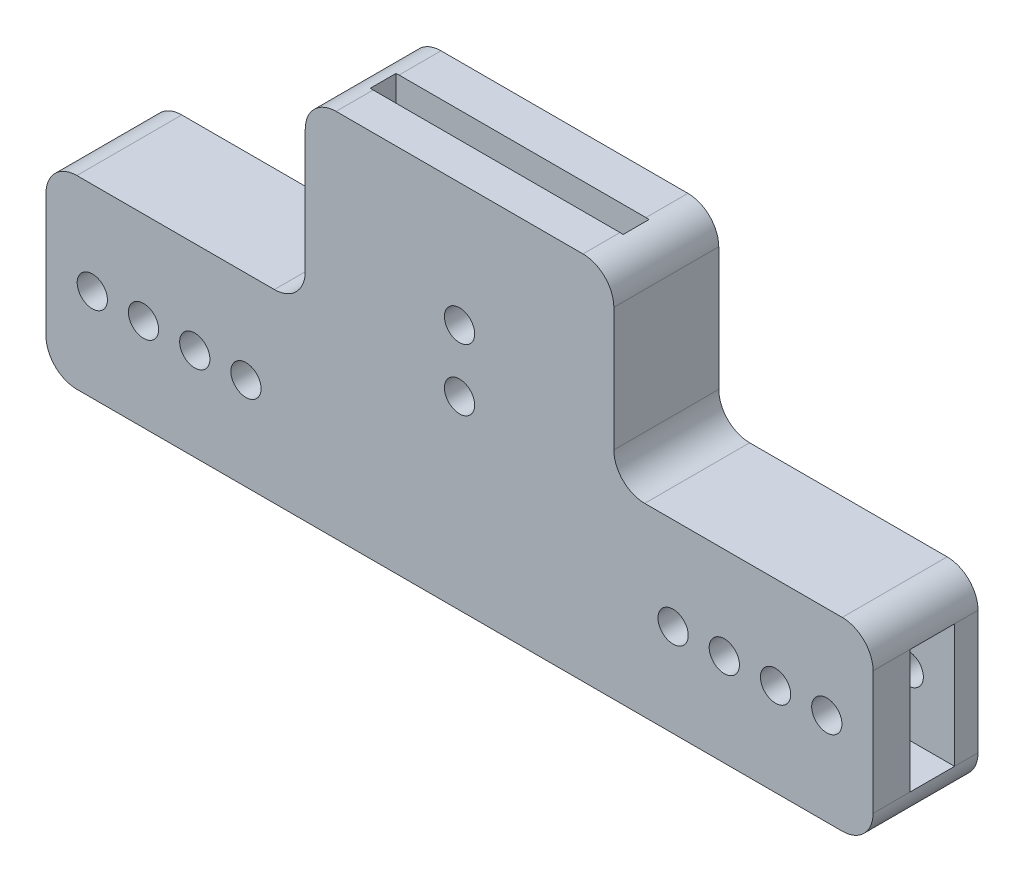
from build123d import *
from build123d.topology import SkipClean

# Parameters (mm, degrees)
SKETCH1_W           = 50
SKETCH1_H           = 60
BOSS_EXTRUDE1_DEPTH = 12
SKETCH2_W           = 41
SKETCH2_H           = 4.2
CUT_EXTRUDE1_DEPTH  = 67.098411479
SKETCH3_W           = 12
SKETCH3_H           = 30
BOSS_EXTRUDE2_DEPTH = 42
SKETCH4_W           = 7.2
SKETCH4_H           = 20
CUT_EXTRUDE2_DEPTH  = 42.5
SKETCH5_R           = 2.45
CUT_EXTRUDE3_DEPTH  = 17.5
FILLET1_R           = 5
SKETCH6_R           = 2.45
CUT_EXTRUDE4_DEPTH  = 35
BOSS_EXTRUDE3_START = 5
SKETCH7_R           = 2.45
BOSS_EXTRUDE3_DEPTH = 5


with BuildPart() as part:
    # Sketch1 → Boss-Extrude1 (new body)
    with BuildSketch(Plane.XY):
        Rectangle(SKETCH1_W, SKETCH1_H)
    extrude(amount=BOSS_EXTRUDE1_DEPTH)

    # Sketch2 → Cut-Extrude1 (cut, through all)
    with BuildSketch(Plane(origin=(0, 30, 0), x_dir=(1, 0, 0), z_dir=(0, 1, 0))):
        with Locations((0, -8.9)):
            Rectangle(SKETCH2_W, SKETCH2_H)
    extrude(amount=-CUT_EXTRUDE1_DEPTH, mode=Mode.SUBTRACT)

    # Sketch3 → Boss-Extrude2 (add)
    with BuildSketch(Plane.ZY.offset(25)):
        with Locations((6, -15)):
            Rectangle(SKETCH3_W, SKETCH3_H)
    boss_extrude2 = extrude(amount=BOSS_EXTRUDE2_DEPTH)

    # Sketch4 → Cut-Extrude2 (cut)
    with BuildSketch(Plane.ZY.offset(67)):
        with Locations((7.4, -15)):
            Rectangle(SKETCH4_W, SKETCH4_H)
    cut_extrude2 = extrude(amount=-CUT_EXTRUDE2_DEPTH, mode=Mode.SUBTRACT)

    # Sketch5 → Cut-Extrude3 (cut, symmetric)
    with BuildSketch(Plane.XY.offset(12)):
        with Locations((-59.5, -14.995756269)):
            Circle(SKETCH5_R)
        with Locations((-51.2, -14.995756269)):
            Circle(SKETCH5_R)
        with Locations((-42.9, -14.995756269)):
            Circle(SKETCH5_R)
        with Locations((-34.6, -14.995756269)):
            Circle(SKETCH5_R)
    cut_extrude3 = extrude(amount=CUT_EXTRUDE3_DEPTH, both=True, mode=Mode.SUBTRACT)

    # Mirror1: Boss-Extrude2, Cut-Extrude2, Cut-Extrude3 across plane
    add(boss_extrude2.mirror(Plane(origin=(0, 0, 0), x_dir=(0, 0, 1), z_dir=(1, 0, 0))))
    add(cut_extrude2.mirror(Plane(origin=(0, 0, 0), x_dir=(0, 0, 1), z_dir=(1, 0, 0))), mode=Mode.SUBTRACT)
    add(cut_extrude3.mirror(Plane(origin=(0, 0, 0), x_dir=(0, 0, 1), z_dir=(1, 0, 0))), mode=Mode.SUBTRACT)

    # Fillet1
    # the kernel refuses this fillet: 5 mm, written as the material it adds along each edge
    with BuildSketch(Plane(origin=(25, 0, 12), x_dir=(0, 1, 0), z_dir=(0, 0, -1))) as fillet1_piece_1:
        with BuildLine():
            CenterArc((FILLET1_R, FILLET1_R), FILLET1_R, 180, 90)
            Line((0, FILLET1_R), (0, 0))
            Line((0, 0), (FILLET1_R, 0))
        make_face()
    extrude(amount=12)
    with BuildSketch(Plane(origin=(-25, 0, 12), x_dir=(0, 1, 0), z_dir=(0, 0, -1))) as fillet1_piece_2:
        with BuildLine():
            CenterArc((FILLET1_R, -FILLET1_R), FILLET1_R, 90, 90)
            Line((0, -FILLET1_R), (0, 0))
            Line((0, 0), (FILLET1_R, 0))
        make_face()
    extrude(amount=12)
    # the kernel refuses this fillet: 5 mm, written as the material it takes off along each edge
    with BuildSketch(Plane(origin=(67, 0, 24.5), x_dir=(-1, 0, 0), z_dir=(0, 0, -1)), Plane(origin=(-67, -30, -12.5), x_dir=(0, 1, 0), z_dir=(0, 0, 1)), Plane(origin=(-25, 30, -12.5), x_dir=(1, 0, 0), z_dir=(0, 0, 1))) as fillet1_2_piece_1:
        with BuildLine():
            CenterArc((FILLET1_R, -FILLET1_R), FILLET1_R, 90, 90)
            Line((0, -FILLET1_R), (0, 0))
            Line((0, 0), (FILLET1_R, 0))
        make_face()
    extrude(amount=37, mode=Mode.SUBTRACT)
    with BuildSketch(Plane(origin=(67, -30, -12.5), x_dir=(0, 1, 0), z_dir=(0, 0, 1)), Plane(origin=(-67, 0, 24.5), x_dir=(1, 0, 0), z_dir=(0, 0, -1)), Plane(origin=(25, 30, -12.5), x_dir=(-1, 0, 0), z_dir=(0, 0, 1))) as fillet1_2_piece_2:
        with BuildLine():
            CenterArc((FILLET1_R, FILLET1_R), FILLET1_R, 180, 90)
            Line((0, FILLET1_R), (0, 0))
            Line((0, 0), (FILLET1_R, 0))
        make_face()
    extrude(amount=37, mode=Mode.SUBTRACT)

    # Sketch6 → Cut-Extrude4 (cut)
    with BuildSketch(Plane.XY.offset(12)):
        Circle(SKETCH6_R)
        with Locations((0, 10)):
            Circle(SKETCH6_R)
    extrude(amount=-CUT_EXTRUDE4_DEPTH, mode=Mode.SUBTRACT)

    # Sketch7 → Boss-Extrude3 (add)
    with SkipClean():  # the faces are left unmerged after this step: merging them gives an invalid solid
        with BuildSketch(Plane.XY.offset(12).offset(BOSS_EXTRUDE3_START)):
            with BuildLine():
                ThreePointArc((-67, -25), (-65.535533906, -28.535533906), (-62, -30))
                Line((-62, -30), (62, -30))
                ThreePointArc((62, -30), (65.535533906, -28.535533906), (67, -25))
                Line((67, -25), (67, -5))
                ThreePointArc((67, -5), (65.535533906, -1.464466094), (62, 0))
                Line((62, 0), (30, 0))
                ThreePointArc((30, 0), (26.464466094, 1.464466094), (25, 5))
                Line((25, 5), (25, 25))
                ThreePointArc((25, 25), (23.535533906, 28.535533906), (20, 30))
                Line((20, 30), (-20, 30))
                ThreePointArc((-20, 30), (-23.535533906, 28.535533906), (-25, 25))
                Line((-25, 25), (-25, 5))
                ThreePointArc((-25, 5), (-26.464466094, 1.464466094), (-30, 0))
                Line((-30, 0), (-62, 0))
                ThreePointArc((-62, 0), (-65.535533906, -1.464466094), (-67, -5))
                Line((-67, -5), (-67, -25))
            make_face()
            with Locations((-59.5, -14.995756269)):
                Circle(SKETCH7_R, mode=Mode.SUBTRACT)
            with Locations((-51.2, -14.995756269)):
                Circle(SKETCH7_R, mode=Mode.SUBTRACT)
            with Locations((-42.9, -14.995756269)):
                Circle(SKETCH7_R, mode=Mode.SUBTRACT)
            with Locations((-34.6, -14.995756269)):
                Circle(SKETCH7_R, mode=Mode.SUBTRACT)
            with Locations((59.5, -14.995756269)):
                Circle(SKETCH7_R, mode=Mode.SUBTRACT)
            with Locations((51.2, -14.995756269)):
                Circle(SKETCH7_R, mode=Mode.SUBTRACT)
            with Locations((42.9, -14.995756269)):
                Circle(SKETCH7_R, mode=Mode.SUBTRACT)
            with Locations((34.6, -14.995756269)):
                Circle(SKETCH7_R, mode=Mode.SUBTRACT)
            with Locations((0, 10)):
                Circle(SKETCH7_R, mode=Mode.SUBTRACT)
            Circle(SKETCH7_R, mode=Mode.SUBTRACT)
        extrude(amount=-BOSS_EXTRUDE3_DEPTH)


solid = part.part
